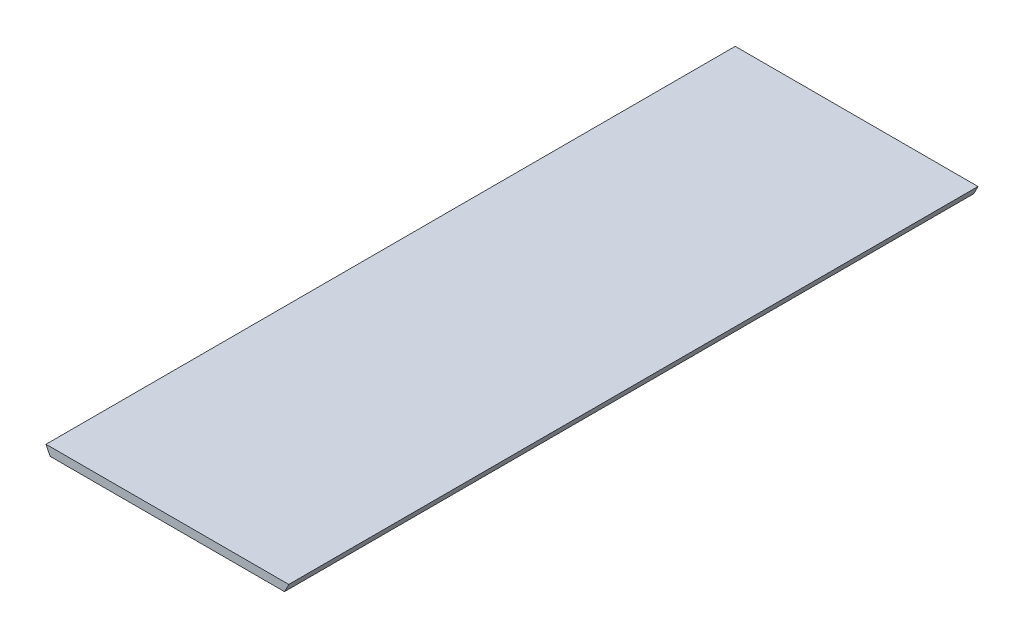
from build123d import *

# Parameters (mm, degrees)
BOSS_EXTRUDE1_DEPTH = 261.62


with BuildPart() as part:
    # Sketch2 → Boss-Extrude1 (new body)
    with BuildSketch(Plane.XY):
        with BuildLine():
            Line((-44.45, -24.593444248), (44.45, -24.593444248))
            ThreePointArc((44.45, -24.593444248), (45.291168316, -23.007609015), (46.075781684, -21.393044248))
            Line((46.075781684, -21.393044248), (-46.075781684, -21.393044248))
            ThreePointArc((-46.075781684, -21.393044248), (-45.291168316, -23.007609015), (-44.45, -24.593444248))
        make_face()
    extrude(amount=BOSS_EXTRUDE1_DEPTH)


solid = part.part
